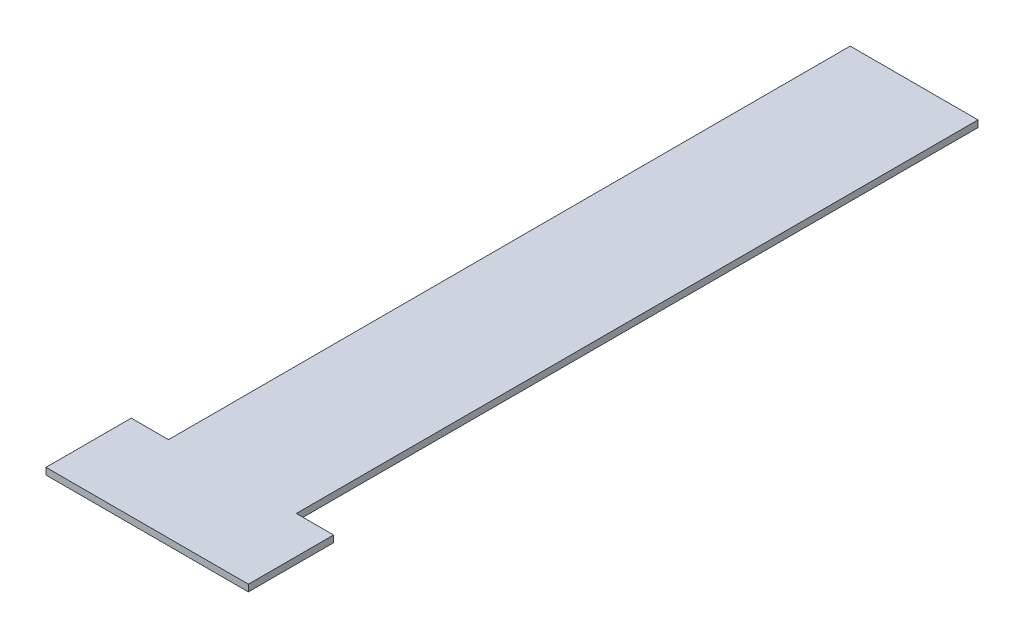
from build123d import *

# Parameters (mm, degrees)
BOSS_EXTRUDE1_DEPTH = 2
SKETCH8_W           = 25.4
SKETCH8_H           = 25.4
BOSS_EXTRUDE2_DEPTH = 2


with BuildPart() as part:
    # Sketch1 → Boss-Extrude1 (new body)
    with BuildSketch(Plane(origin=(0, 0, 0), x_dir=(1, 0, 0), z_dir=(0, 1, 0))):
        Polygon((-29.123295379, 223.557352941), (8.976704621, 223.557352941), (8.976704621, 20.357352941), (-5.310795379, 20.357352941), (-5.310795379, -5.042647059), (-14.835795379, -5.042647059), (-14.835795379, 20.357352941), (-29.123295379, 20.357352941), align=None)
    extrude(amount=BOSS_EXTRUDE1_DEPTH)

    # Sketch8 → Boss-Extrude2 (add)
    with BuildSketch(Plane(origin=(0, 2, 0), x_dir=(1, 0, 0), z_dir=(0, 1, 0))):
        with Locations((-27.535795379, 7.657352941)):
            Rectangle(SKETCH8_W, SKETCH8_H)
        with Locations((7.389204621, 7.657352941)):
            Rectangle(SKETCH8_W, SKETCH8_H)
    extrude(amount=-BOSS_EXTRUDE2_DEPTH)


solid = part.part
